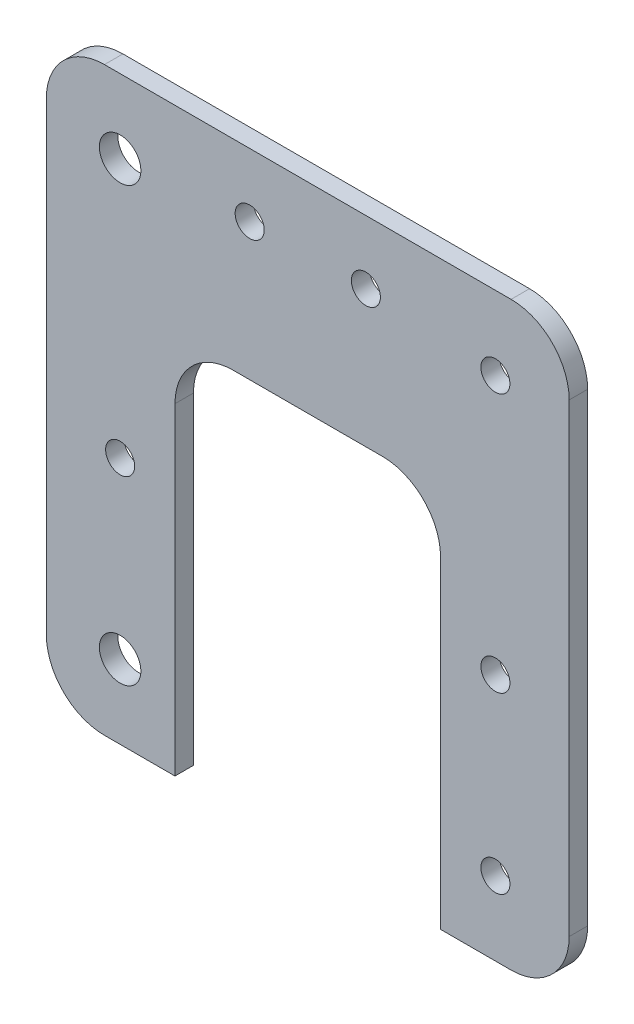
from build123d import *

# Parameters (mm, degrees)
BOSS_EXTRUDE1_START = 19.16
SKETCH1_W           = 90
SKETCH1_H           = 100
SKETCH1_R           = 2.5
SKETCH1_R_2         = 3.57
BOSS_EXTRUDE1_DEPTH = 3.18
SKETCH2_W           = 45.72
SKETCH2_H           = 65.511870912
CUT_EXTRUDE1_DEPTH  = 72.134467033
FILLET1_R           = 10
SKETCH3_R           = 2.5
CUT_EXTRUDE2_DEPTH  = 72.134467033


with BuildPart() as part:
    # Sketch1 → Boss-Extrude1 (new body)
    with BuildSketch(Plane.XY.offset(BOSS_EXTRUDE1_START)):
        with Locations((0, -5)):
            Rectangle(SKETCH1_W, SKETCH1_H)
        with Locations((32.3, -12.3)):
            Circle(SKETCH1_R, mode=Mode.SUBTRACT)
        with Locations((32.3, -42.3)):
            Circle(SKETCH1_R, mode=Mode.SUBTRACT)
        with Locations((-32.3, -42.3)):
            Circle(SKETCH1_R_2, mode=Mode.SUBTRACT)
        with Locations((-32.3, -12.3)):
            Circle(SKETCH1_R, mode=Mode.SUBTRACT)
        with Locations((-32.3, 32.3)):
            Circle(SKETCH1_R_2, mode=Mode.SUBTRACT)
        with Locations((32.3, 32.3)):
            Circle(SKETCH1_R, mode=Mode.SUBTRACT)
    extrude(amount=-BOSS_EXTRUDE1_DEPTH)

    # Sketch2 → Cut-Extrude1 (cut, through all)
    with BuildSketch(Plane(origin=(0, 0, 15.98), x_dir=(-1, 0, 0), z_dir=(0, 0, -1))):
        with Locations((0, -22.244064544)):
            Rectangle(SKETCH2_W, SKETCH2_H)
    extrude(amount=-CUT_EXTRUDE1_DEPTH, mode=Mode.SUBTRACT)

    # Fillet1
    fillet1_edges = [part.edges().sort_by_distance(p)[0] for p in [
        (45, -55, 17.57),
        (-45, -55, 17.57),
        (-45, 45, 17.57),
        (45, 45, 17.57),
        (-22.86, 10.511870912, 17.57),
        (22.86, 10.511870912, 17.57),
    ]]
    fillet(fillet1_edges, radius=FILLET1_R)

    # Sketch3 → Cut-Extrude2 (cut, through all)
    with BuildSketch(Plane.XY.offset(19.16)):
        with Locations((10.000000001, 34.069134235)):
            Circle(SKETCH3_R)
        with Locations((-9.999999999, 34.069134245)):
            Circle(SKETCH3_R)
    extrude(amount=-CUT_EXTRUDE2_DEPTH, mode=Mode.SUBTRACT)


solid = part.part
